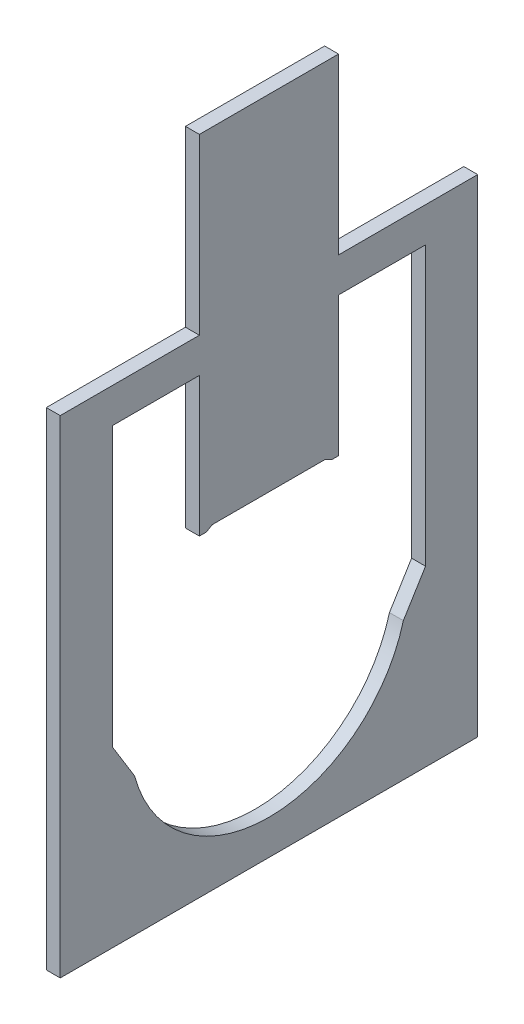
from build123d import *

# Parameters (mm, degrees)
BOSS_EXTRUDE1_DEPTH = 2


with BuildPart() as part:
    # Sketch1 → Boss-Extrude1 (new body)
    with BuildSketch(Plane(origin=(0, 0, 0), x_dir=(0, 0, -1), z_dir=(1, 0, 0))):
        Polygon((20, 0), (0, 0), (0, 25), (-20, 25), (-20, 0), (-40, 0), (-40, -70), (20, -70), align=None)
        with BuildLine():
            ThreePointArc((9.318516526, -50.176380902), (-10, -65), (-29.318516526, -50.176380902))
            Line((-29.318516526, -50.176380902), (-32.5, -45))
            Line((-32.5, -45), (-32.5, -5))
            Line((-32.5, -5), (-20, -5))
            Line((-20, -5), (-20, -25))
            Line((-20, -25), (-19, -25))
            Line((-19, -25), (-18.133974596, -24.5))
            Line((-18.133974596, -24.5), (-1.866025404, -24.5))
            Line((-1.866025404, -24.5), (-1, -25))
            Line((-1, -25), (0, -25))
            Line((0, -25), (0, -4.981590289))
            Line((0, -4.981590289), (12.5, -5))
            Line((12.5, -5), (12.5, -45))
            Line((12.5, -45), (9.318516526, -50.176380902))
        make_face(mode=Mode.SUBTRACT)
    extrude(amount=BOSS_EXTRUDE1_DEPTH)


solid = part.part
